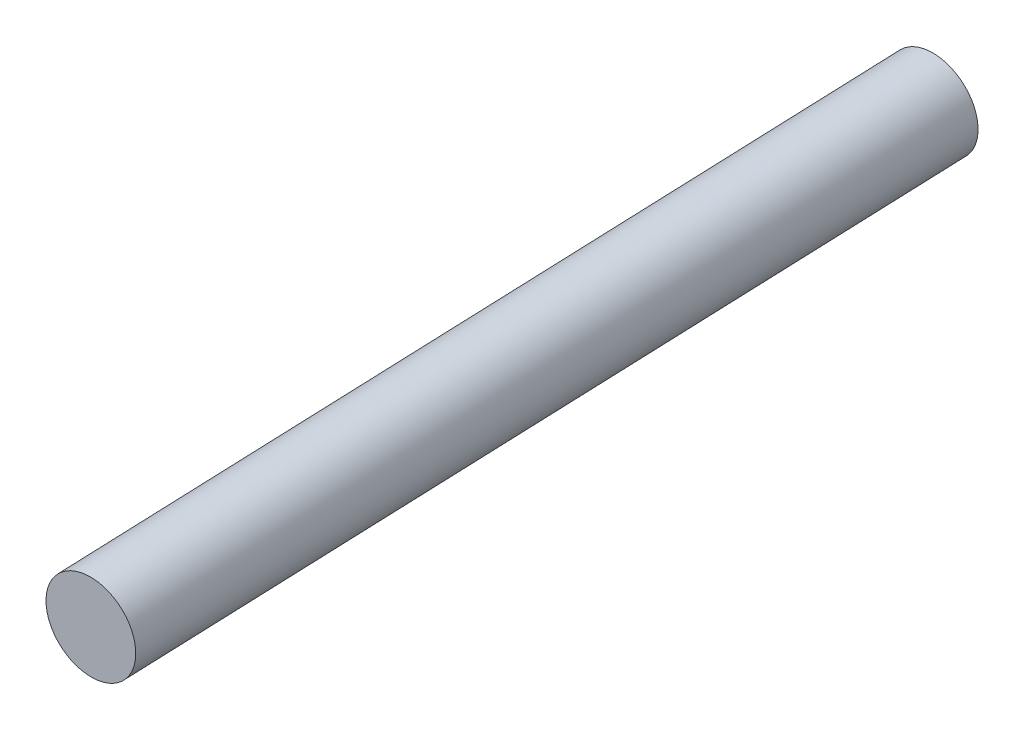
from build123d import *

# Parameters (mm, degrees)
SWEEP1_PROFILE_R = 17.145


with BuildPart() as part:
    # Sweep1: sweep along a curve in space
    with BuildLine() as sweep1_path:
        Line((-1565.75455637, 2063.335255065, -1077.803991496), (-1561.137499671, 2055.275245076, -746.817890705))
    # Sweep1 profile (on start of the path) → Sweep1 (sweep)
    with BuildSketch(Plane(origin=(-1565.75455637, 2063.335255065, -1077.803991496), x_dir=(0, 0.9997036338813965, 0.024344288946914365), z_dir=(0.013943907633912785, -0.024341922170652265, 0.9996064416883952))):
        Circle(SWEEP1_PROFILE_R)
    sweep(path=sweep1_path.line)


solid = part.part
